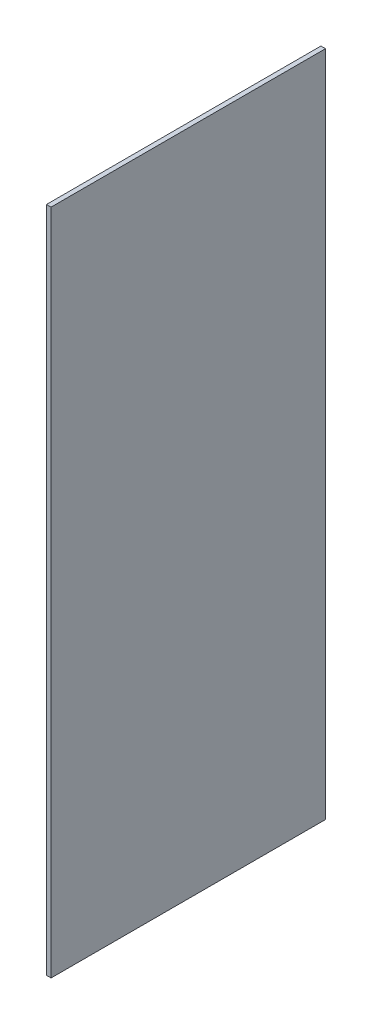
from build123d import *

# Parameters (mm, degrees)
SKETCH1_W           = 189.738
SKETCH1_H           = 461.518
BOSS_EXTRUDE1_DEPTH = 3.175


with BuildPart() as part:
    # Sketch1 → Boss-Extrude1 (new body)
    with BuildSketch(Plane(origin=(0, 0, 0), x_dir=(0, 0, -1), z_dir=(1, 0, 0))):
        with Locations((-94.869, 230.759)):
            Rectangle(SKETCH1_W, SKETCH1_H)
    extrude(amount=BOSS_EXTRUDE1_DEPTH)


solid = part.part
